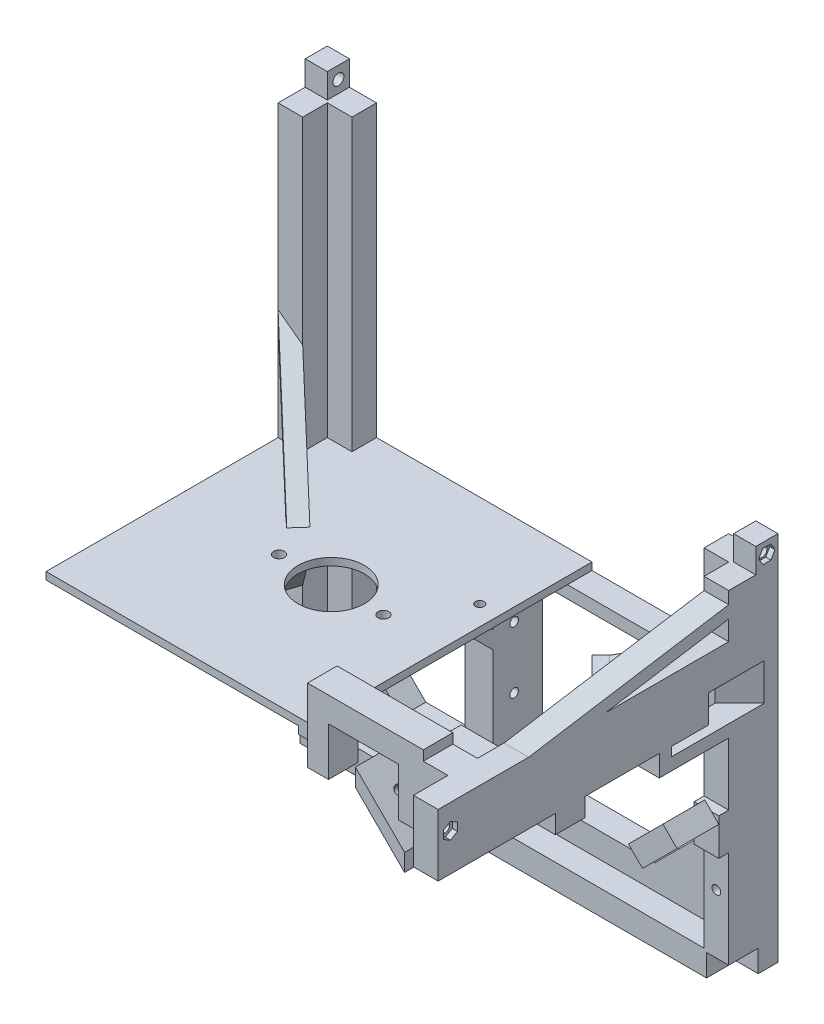
from build123d import *
from OCP.BRepFilletAPI import BRepFilletAPI_MakeChamfer

# Parameters (mm, degrees)
BOSS_EXTRUDE1_DEPTH       = 10
BOSS_EXTRUDE2_DEPTH       = 10
SKETCH3_W                 = 9
SKETCH3_H                 = 9
BOSS_EXTRUDE3_DEPTH       = 10
SKETCH5_W                 = 9
SKETCH5_H                 = 9
BOSS_EXTRUDE4_DEPTH       = 10
SKETCH6_R                 = 2.25
CUT_EXTRUDE1_DEPTH        = 9
SKETCH7_R                 = 2.25
CUT_EXTRUDE2_DEPTH        = 9
SKETCH8_R                 = 1.75
CUT_EXTRUDE3_DEPTH        = 250.05692246
SKETCH9_W                 = 10
SKETCH9_H                 = 25.2
BOSS_EXTRUDE5_DEPTH       = 118
BOSS_EXTRUDE8_DEPTH       = 5
CUT_EXTRUDE8_REACH        = 296.761
SKETCH17_W                = 16
SKETCH17_H                = 14
BOSS_EXTRUDE10_DEPTH      = 5
BOSS_EXTRUDE11_DEPTH      = 6.668368611
SKETCH22_W                = 50.253151342
SKETCH22_H                = 12
BOSS_EXTRUDE12_DEPTH      = 7.5
BOSS_EXTRUDE13_DEPTH      = 10
SKETCH26_W                = 12
SKETCH26_H                = 25.7
BOSS_EXTRUDE14_DEPTH      = 20
BOSS_EXTRUDE15_DEPTH      = 4
BOSS_EXTRUDE15_DEPTH_BACK = 6.1
SKETCH28_W                = 47
SKETCH28_H                = 12
SKETCH29_W                = 8.5
SKETCH29_H                = 19.6
BOSS_EXTRUDE16_DEPTH      = 12
SKETCH30_R                = 1.75
CUT_EXTRUDE11_DEPTH       = 10
SKETCH38_W                = 20
SKETCH38_H                = 13.31
BOSS_EXTRUDE19_DEPTH      = 5.1
SKETCH41_W                = 11.52
SKETCH41_H                = 20
BOSS_EXTRUDE21_DEPTH      = 90.06
SKETCH45_W                = 20
SKETCH45_H                = 28.01
BOSS_EXTRUDE25_DEPTH      = 34.49
BOSS_EXTRUDE26_DEPTH      = 11.52
SKETCH53_R                = 2.2
CUT_EXTRUDE20_DEPTH       = 5
CUT_EXTRUDE17_START       = -28.01
CUT_EXTRUDE17_DEPTH       = 23.01
BOSS_EXTRUDE27_REACH      = 284.27
SKETCH54_W                = 5
SKETCH54_H                = 5
SKETCH55_W                = 75.65
SKETCH55_H                = 5
BOSS_EXTRUDE28_DEPTH      = 10
SKETCH56_W                = 3.02
SKETCH56_H                = 26
CUT_EXTRUDE21_DEPTH       = 5
SKETCH23_W                = 18
SKETCH23_H                = 7.5
CUT_EXTRUDE22_DEPTH       = 2.2
CHAMFER1_SIZE             = 0.5
CHAMFER1_SIZE2            = 1.866025404
BOSS_EXTRUDE31_DEPTH      = 7.5
BOSS_EXTRUDE31_DEPTH_BACK = 7.5
SKETCH60_W                = 10
SKETCH60_H                = 4
BOSS_EXTRUDE32_DEPTH      = 17
SKETCH39_R                = 1.75
CUT_EXTRUDE25_DEPTH       = 10
SKETCH63_R                = 2.25
CUT_EXTRUDE26_DEPTH       = 10
SKETCH64_R                = 13.5
BOSS_EXTRUDE33_DEPTH      = 3
SKETCH65_R                = 2.2
CUT_EXTRUDE27_DEPTH       = 8.005
SKETCH66_R                = 1.75
CUT_EXTRUDE28_DEPTH       = 3
CUT_EXTRUDE30_DEPTH       = 2.1
CUT_EXTRUDE31_DEPTH       = 2.1
CUT_EXTRUDE32_DEPTH       = 2.1
SKETCH72_W                = 9
SKETCH72_H                = 9
CUT_EXTRUDE33_DEPTH       = 12
SKETCH74_R                = 1.8
CUT_EXTRUDE35_DEPTH       = 10
CHAMFER2_SIZE             = 0.5
CHAMFER2_SIZE2            = 1.866025404
BOSS_EXTRUDE34_DEPTH      = 2.18951549
CUT_EXTRUDE36_DEPTH       = 2.1
BOSS_EXTRUDE36_DEPTH      = 10
SKETCH82_W                = 16
SKETCH82_H                = 1
CUT_EXTRUDE37_DEPTH       = 37.542136
SKETCH83_R                = 2.25
BOSS_EXTRUDE37_DEPTH      = 6.8
BOSS_EXTRUDE38_DEPTH      = 12
BOSS_EXTRUDE39_DEPTH      = 13
BOSS_EXTRUDE41_DEPTH      = 2
CUT_EXTRUDE38_START       = -9.5
SKETCH89_W                = 25
SKETCH89_H                = 5
CUT_EXTRUDE38_DEPTH       = 9.5
SKETCH90_R                = 2.2
CUT_EXTRUDE39_DEPTH       = 5
CUT_EXTRUDE40_DEPTH       = 17
SKETCH93_R                = 1.75
CUT_EXTRUDE41_DEPTH       = 8.09
SKETCH94_R                = 1.75
CUT_EXTRUDE42_DEPTH       = 5
SKETCH95_R                = 1.75
CUT_EXTRUDE43_DEPTH       = 11.52


with BuildPart() as part:
    # Sketch1 → Boss-Extrude1 (new body)
    with BuildSketch(Plane.XY):
        Polygon((0, 0), (-91.5, 0), (-91.5, 220.775), (-71.5, 220.775), (-71.5, 40), (-51.5, 20), (0, 20), (51.5, 20), (71.5, 40), (71.5, 140.775), (91.5, 140.775), (91.5, 0), align=None)
    extrude(amount=BOSS_EXTRUDE1_DEPTH)

    # Sketch2 → Boss-Extrude2 (add)
    with BuildSketch(Plane.XY.offset(10)):
        Polygon((-81.5, 220.775), (-91.5, 220.775), (-91.5, 0), (91.5, 0), (91.5, 140.775), (81.5, 140.775), (81.5, 10), (-81.5, 10), align=None)
    extrude(amount=BOSS_EXTRUDE2_DEPTH)

    # Sketch3 → Boss-Extrude3 (add)
    with BuildSketch(Plane(origin=(0, 220.775, 0), x_dir=(1, 0, 0), z_dir=(0, 1, 0))):
        with Locations((-87, -4.5)):
            Rectangle(SKETCH3_W, SKETCH3_H)
    extrude(amount=BOSS_EXTRUDE3_DEPTH)

    # Sketch5 → Boss-Extrude4 (add)
    with BuildSketch(Plane(origin=(0, 140.775, 0), x_dir=(1, 0, 0), z_dir=(0, 1, 0))):
        with Locations((87, -4.5)):
            Rectangle(SKETCH5_W, SKETCH5_H)
    extrude(amount=BOSS_EXTRUDE4_DEPTH)

    # Sketch6 → Cut-Extrude1 (cut)
    with BuildSketch(Plane.ZY.offset(91.5)):
        with Locations(Location((4.5, 225.775, 0), (0, 0, 270))):
            Circle(SKETCH6_R)
    extrude(amount=-CUT_EXTRUDE1_DEPTH, mode=Mode.SUBTRACT)

    # Sketch7 → Cut-Extrude2 (cut)
    with BuildSketch(Plane(origin=(91.5, 0, 0), x_dir=(0, 0, -1), z_dir=(1, 0, 0))):
        with Locations(Location((-4.5, 145.775, 0), (0, 0, 90))):
            Circle(SKETCH7_R)
    extrude(amount=-CUT_EXTRUDE2_DEPTH, mode=Mode.SUBTRACT)

    # Sketch8 → Cut-Extrude3 (cut, through all)
    with BuildSketch(Plane(origin=(0, 0, 0), x_dir=(-1, 0, 0), z_dir=(0, 0, -1))):
        with Locations((86.5, 33)):
            Circle(SKETCH8_R)
        with Locations((-86.5, 33)):
            Circle(SKETCH8_R)
    extrude(amount=-CUT_EXTRUDE3_DEPTH, mode=Mode.SUBTRACT)

    # Sketch9 → Boss-Extrude5 (add)
    with BuildSketch(Plane.XY.offset(20)):
        with Locations((86.5, 110.165)):
            Rectangle(SKETCH9_W, SKETCH9_H)
    extrude(amount=BOSS_EXTRUDE5_DEPTH)

    # Sketch16 → Boss-Extrude8 (add)
    with BuildSketch(Plane(origin=(0, 107.915, 0), x_dir=(-1, 0, 0), z_dir=(0, -1, 0))):
        Polygon((-81.5, -38.192388155), (-81.5, -19.807611845), (-63.46877708, -37.838834765), (-72.661165235, -47.03122292), align=None)
    extrude(amount=-BOSS_EXTRUDE8_DEPTH)

    # Cut-Extrude8: up to this plane
    cut_extrude8_end = Plane(origin=(91.5, 140.775, 10), z_dir=(-1, 0, 0))
    # Sketch17 → Cut-Extrude8 (cut, up to the surface)
    with BuildSketch(Plane(origin=(12.814971157, 0, -12.814971157), x_dir=(0.7071067811865518, 0, 0.7071067811865434), z_dir=(-0.7071067811865434, 0, 0.7071067811865518)), mode=Mode.PRIVATE) as cut_extrude8_sk1:
        with Locations((76.635299321, 100.915)):
            Rectangle(SKETCH17_W, SKETCH17_H)
    cut_extrude8_tool1 = split(extrude(cut_extrude8_sk1.sketch, amount=-CUT_EXTRUDE8_REACH, mode=Mode.PRIVATE), bisect_by=cut_extrude8_end, keep=Keep.BOTH, mode=Mode.PRIVATE)
    add(cut_extrude8_tool1.solids().sort_by_distance((67.004311, 100.915, 41.374369))[0], mode=Mode.SUBTRACT)

    # Sketch20 → Boss-Extrude10 (add)
    with BuildSketch(Plane(origin=(0, 98.065, 0), x_dir=(1, 0, 0), z_dir=(0, 1, 0))):
        Polygon((-81.5, -20), (-91.5, -20), (-54.713161009, -52.918273519), (-54.713161009, -66.918273519), (-45.713161009, -66.918273519), (-45.713161009, -52.02343519), align=None)
    extrude(amount=BOSS_EXTRUDE10_DEPTH)

    # Sketch21 → Boss-Extrude11 (add)
    with BuildSketch(Plane(origin=(-50.626019377, 0, 56.575604505), x_dir=(0.7452037309705689, 0, 0.6668368611193775), z_dir=(-0.6668368611193775, 0, 0.7452037309705689))):
        Polygon((-5.484596308, 98.065), (-54.849404161, 48.700192147), (-54.849404161, 53.700192147), (-10.484596308, 98.065), align=None)
        Polygon((-54.849404161, 148.065), (-9.849404161, 103.065), (-14.849404161, 103.065), (-54.849404161, 143.065), align=None)
    extrude(amount=-BOSS_EXTRUDE11_DEPTH)

    # Sketch22 → Boss-Extrude12 (add)
    with BuildSketch(Plane.XZ.offset(-97.565)):
        with Locations((66.373424329, 84.38)):
            Rectangle(SKETCH22_W, SKETCH22_H)
    extrude(amount=BOSS_EXTRUDE12_DEPTH)

    # Sketch25 → Boss-Extrude13 (add)
    with BuildSketch(Plane(origin=(91.5, 0, 0), x_dir=(0, 0, -1), z_dir=(1, 0, 0))):
        Polygon((-20, 135.775), (-101.210986267, 122.765), (-70, 122.765), (-20, 130.775), align=None)
    extrude(amount=-BOSS_EXTRUDE13_DEPTH)

    # Sketch26 → Boss-Extrude14 (add)
    with BuildSketch(Plane.ZY.offset(-81.5)):
        with Locations((118.03, 109.915)):
            Rectangle(SKETCH26_W, SKETCH26_H)
    extrude(amount=BOSS_EXTRUDE14_DEPTH)

    # Sketch28 → Boss-Extrude15 (add, two sides: drawn at the far end of the back side and taken through both)
    with BuildSketch(Plane(origin=(0, 122.765, 0), x_dir=(1, 0, 0), z_dir=(0, 1, 0)).offset(-BOSS_EXTRUDE15_DEPTH_BACK)):
        with Locations((48, -118.03)):
            Rectangle(SKETCH28_W, SKETCH28_H)
    extrude(amount=BOSS_EXTRUDE15_DEPTH + BOSS_EXTRUDE15_DEPTH_BACK)

    # Sketch29 → Boss-Extrude16 (add)
    with BuildSketch(Plane.XY.offset(124.03)):
        with Locations((28.75, 106.865)):
            Rectangle(SKETCH29_W, SKETCH29_H)
    extrude(amount=-BOSS_EXTRUDE16_DEPTH)

    # Sketch30 → Cut-Extrude11 (cut)
    with BuildSketch(Plane.XZ.offset(-97.065)):
        with Locations(Location((29.75, 117.76, 0), (0, 0, 270))):
            Circle(SKETCH30_R)
        with Locations(Location((64.75, 117.76, 0), (0, 0, 270))):
            Circle(SKETCH30_R)
    extrude(amount=-CUT_EXTRUDE11_DEPTH, mode=Mode.SUBTRACT)

    # Sketch38 → Boss-Extrude19 (add)
    with BuildSketch(Plane(origin=(12.814971157, 0, -12.814971157), x_dir=(0.7071067811865579, 0, 0.7071067811865371), z_dir=(-0.7071067811865371, 0, 0.7071067811865579))):
        with Locations((74.588955898, 101.26)):
            Rectangle(SKETCH38_W, SKETCH38_H)
    extrude(amount=-BOSS_EXTRUDE19_DEPTH)

    # Sketch45 → Boss-Extrude25 (add)
    with BuildSketch(Plane.XZ):
        with Locations((-22.11, 34.005)):
            Rectangle(SKETCH45_W, SKETCH45_H)
    extrude(amount=-BOSS_EXTRUDE25_DEPTH)


with BuildPart() as body_2:
    # Sketch41 → Boss-Extrude21 (new body)
    with BuildSketch(Plane(origin=(0, 10, 0), x_dir=(1, 0, 0), z_dir=(0, 1, 0))):
        with Locations((-9.91, -10)):
            Rectangle(SKETCH41_W, SKETCH41_H)
    extrude(amount=BOSS_EXTRUDE21_DEPTH)


    add(part.part)  # Boss-Extrude26 merges part
    # Sketch52 → Boss-Extrude26 (add)
    with BuildSketch(Plane.ZY.offset(15.67)):
        Polygon((20, 100.06), (68, 100.06), (68, 95.06), (43, 95.06), (20, 72.06), (20, 79.131067812), (35.928932188, 95.06), (20, 95.06), align=None)
    extrude(amount=-BOSS_EXTRUDE26_DEPTH)

    # Sketch53 → Cut-Extrude20 (cut)
    with BuildSketch(Plane.XZ.offset(-95.06)):
        with Locations((-7.786838991, 60.918273519)):
            Circle(SKETCH53_R)
    extrude(amount=-CUT_EXTRUDE20_DEPTH, mode=Mode.SUBTRACT)

    # Sketch47 → Cut-Extrude17 (cut)
    with BuildSketch(Plane(origin=(0, 0, 20), x_dir=(-1, 0, 0), z_dir=(0, 0, -1)).offset(CUT_EXTRUDE17_START)):
        Polygon((39.920582555, 38.688332232), (4.453597068, 3.221346744), (-9.950768342, 17.625712154), (25.516217145, 53.092697642), align=None)
        Polygon((35.225802789, 26.922484654), (9.905484844, 1.602166709), (23.182353081, -11.674701529), (48.502671027, 13.645616416), align=None)
    extrude(amount=CUT_EXTRUDE17_DEPTH, mode=Mode.SUBTRACT)

    # Boss-Extrude27: up to this plane
    boss_extrude27_end = Plane(origin=(-15.67, 100.06, 20), z_dir=(1, 0, 0))
    # Sketch54 → Boss-Extrude27 (add, up to the surface)
    with BuildSketch(Plane(origin=(-46.179305384, 0, 51.606311337), x_dir=(-0.7452037309705689, 0, -0.6668368611193775), z_dir=(0.6668368611193775, 0, -0.7452037309705689)), mode=Mode.PRIVATE) as boss_extrude27_sk1:
        with Locations((4.113698153, 100.565)):
            Rectangle(SKETCH54_W, SKETCH54_H)
    boss_extrude27_tool1 = split(extrude(boss_extrude27_sk1.sketch, amount=BOSS_EXTRUDE27_REACH, mode=Mode.PRIVATE), bisect_by=boss_extrude27_end, keep=Keep.BOTH, mode=Mode.PRIVATE)
    add(boss_extrude27_tool1.solids().sort_by_distance((-49.244849, 100.565, 48.863146))[0])

    # Sketch55 → Boss-Extrude28 (add)
    with BuildSketch(Plane(origin=(0, 0, 0), x_dir=(-1, 0, 0), z_dir=(0, 0, -1))):
        with Locations((-33.675, 97.56)):
            Rectangle(SKETCH55_W, SKETCH55_H)
    extrude(amount=-BOSS_EXTRUDE28_DEPTH)

    # Sketch56 → Cut-Extrude21 (cut)
    with BuildSketch(Plane.XZ.offset(-95.06)):
        with Locations((-15.16, 56)):
            Rectangle(SKETCH56_W, SKETCH56_H)
    extrude(amount=-CUT_EXTRUDE21_DEPTH, mode=Mode.SUBTRACT)

    # Sketch23 → Cut-Extrude22 (cut)
    with BuildSketch(Plane.XY.offset(90.38)):
        with Locations((50.246848658, 93.815)):
            Rectangle(SKETCH23_W, SKETCH23_H)
    extrude(amount=-CUT_EXTRUDE22_DEPTH, mode=Mode.SUBTRACT)

    # Chamfer1: one chamfer whose edges measure the first distance from different faces: ONE call of the kernel's chamfer builder (chamfer() names one face for all edges)
    chamfer1_edges_1 = [body_2.edges().sort_by_distance(p)[0] for p in [
        (29.75, 97.065, 119.51),
    ]]
    chamfer1_side_1 = [body_2.faces().sort_by_distance(p)[0] for p in [
        (32.852945588, 97.065, 118.03),
    ]]
    chamfer1_edges_2 = [body_2.edges().sort_by_distance(p)[0] for p in [
        (64.75, 97.065, 119.51),
    ]]
    chamfer1_side_2 = [body_2.faces().sort_by_distance(p)[0] for p in [
        (71.781894819, 97.065, 118.041275793),
    ]]
    chamfer1 = BRepFilletAPI_MakeChamfer(body_2.part.solid().wrapped)
    for e in chamfer1_edges_1:
        chamfer1.Add(CHAMFER1_SIZE, CHAMFER1_SIZE2, e.wrapped, chamfer1_side_1[0].wrapped)  # the first distance lies on this face
    for e in chamfer1_edges_2:
        chamfer1.Add(CHAMFER1_SIZE, CHAMFER1_SIZE2, e.wrapped, chamfer1_side_2[0].wrapped)  # the first distance lies on this face
    add(Compound.cast(chamfer1.Shape()), mode=Mode.REPLACE)

    # Sketch60 → Boss-Extrude31 (add, two sides: drawn at the far end of the back side and taken through both)
    with BuildSketch(Plane(origin=(0, 56.04, 0), x_dir=(-1, 0, 0), z_dir=(0, -1, 0)).offset(-BOSS_EXTRUDE31_DEPTH_BACK)):
        with Locations((-86.5, -22)):
            Rectangle(SKETCH60_W, SKETCH60_H)
    extrude(amount=BOSS_EXTRUDE31_DEPTH + BOSS_EXTRUDE31_DEPTH_BACK)

    # Sketch61 → Boss-Extrude32 (add)
    with BuildSketch(Plane.XY.offset(24)):
        Polygon((85.277460326, 66.762539674), (71.277460326, 52.762539674), (77.5, 46.54), (91.5, 60.54), align=None)
    extrude(amount=BOSS_EXTRUDE32_DEPTH)

    # Sketch39 → Cut-Extrude25 (cut)
    with BuildSketch(Plane(origin=(91.5, 0, 0), x_dir=(0, 0, -1), z_dir=(1, 0, 0))):
        with Locations(Location((-133, 112.765, 0), (0, 0, 90))):
            Circle(SKETCH39_R)
    extrude(amount=-CUT_EXTRUDE25_DEPTH, mode=Mode.SUBTRACT)

    # Sketch63 → Cut-Extrude26 (cut)
    with BuildSketch(Plane(origin=(16.421215742, 0, -16.421215742), x_dir=(-0.7071067811865579, 0, -0.7071067811865372), z_dir=(0.7071067811865372, 0, -0.7071067811865579))):
        with Locations((-75.848955898, 102.51)):
            Circle(SKETCH63_R)
    extrude(amount=-CUT_EXTRUDE26_DEPTH, mode=Mode.SUBTRACT)

    # Sketch64 → Boss-Extrude33 (add)
    with BuildSketch(Plane(origin=(0, 103.065, 0), x_dir=(1, 0, 0), z_dir=(0, 1, 0))):
        Polygon((-91.5, -114.21951549), (-91.5, -14.5), (-81.5, -15), (-81.5, 0), (16, 0), (16, -114.21951549), align=None)
        with Locations(Location((-29, -60.918273519, 0), (0, 0, 270))):
            Circle(SKETCH64_R, mode=Mode.SUBTRACT)
    extrude(amount=-BOSS_EXTRUDE33_DEPTH)

    # Sketch65 → Cut-Extrude27 (cut)
    with BuildSketch(Plane.XZ.offset(-95.06)):
        with Locations((-7.786838991, 60.918273519)):
            Circle(SKETCH65_R)
        with Locations(Location((-50.213161009, 60.918273519, 0), (0, 0, 90))):
            Circle(SKETCH65_R)
    extrude(amount=-CUT_EXTRUDE27_DEPTH, mode=Mode.SUBTRACT)

    # Sketch66 → Cut-Extrude28 (cut)
    with BuildSketch(Plane.XZ.offset(-100.065)):
        with Locations(Location((8, 37.59, 0), (0, 0, 270))):
            Circle(SKETCH66_R)
    extrude(amount=-CUT_EXTRUDE28_DEPTH, mode=Mode.SUBTRACT)

    # Sketch69 → Cut-Extrude30 (cut)
    with BuildSketch(Plane(origin=(0, 0, 0), x_dir=(-1, 0, 0), z_dir=(0, 0, -1))):
        Polygon((-88.145448267, 30.15), (-84.854551733, 30.15), (-83.209103466, 33), (-84.854551733, 35.85), (-88.145448267, 35.85), (-89.790896534, 33), align=None)
        Polygon((88.145448267, 30.15), (89.790896534, 33), (88.145448267, 35.85), (84.854551733, 35.85), (83.209103466, 33), (84.854551733, 30.15), align=None)
    extrude(amount=-CUT_EXTRUDE30_DEPTH, mode=Mode.SUBTRACT)

    # Sketch70 → Cut-Extrude31 (cut)
    with BuildSketch(Plane(origin=(91.5, 0, 0), x_dir=(0, 0, -1), z_dir=(1, 0, 0))):
        Polygon((-2.854551733, 142.925), (-1.209103466, 145.775), (-2.854551733, 148.625), (-6.145448267, 148.625), (-7.790896534, 145.775), (-6.145448267, 142.925), align=None)
    extrude(amount=-CUT_EXTRUDE31_DEPTH, mode=Mode.SUBTRACT)

    # Sketch71 → Cut-Extrude32 (cut)
    with BuildSketch(Plane.ZY.offset(91.5)):
        Polygon((6.145448267, 222.925), (7.790896534, 225.775), (6.145448267, 228.625), (2.854551733, 228.625), (1.209103466, 225.775), (2.854551733, 222.925), align=None)
    extrude(amount=-CUT_EXTRUDE32_DEPTH, mode=Mode.SUBTRACT)

    # Sketch72 → Cut-Extrude33 (cut)
    with BuildSketch(Plane.XY.offset(20)):
        with Locations((87, 4.5)):
            Rectangle(SKETCH72_W, SKETCH72_H)
        with Locations((-87, 4.5)):
            Rectangle(SKETCH72_W, SKETCH72_H)
    extrude(amount=-CUT_EXTRUDE33_DEPTH, mode=Mode.SUBTRACT)

    # Sketch74 → Cut-Extrude35 (cut)
    with BuildSketch(Plane.XZ.offset(-9)):
        with Locations(Location((-87, 14, 0), (0, 0, 270))):
            Circle(SKETCH74_R)
        with Locations(Location((87, 14, 0), (0, 0, 270))):
            Circle(SKETCH74_R)
    extrude(amount=-CUT_EXTRUDE35_DEPTH, mode=Mode.SUBTRACT)

    # Chamfer2: one chamfer whose edges measure the first distance from different faces: ONE call of the kernel's chamfer builder (chamfer() names one face for all edges)
    chamfer2_edges_1 = [body_2.edges().sort_by_distance(p)[0] for p in [
        (-87, 9, 15.8),
    ]]
    chamfer2_side_1 = [body_2.faces().sort_by_distance(p)[0] for p in [
        (-82.65, 9, 14),
    ]]
    chamfer2_edges_2 = [body_2.edges().sort_by_distance(p)[0] for p in [
        (87, 9, 15.8),
    ]]
    chamfer2_side_2 = [body_2.faces().sort_by_distance(p)[0] for p in [
        (82.65, 9, 14),
    ]]
    chamfer2 = BRepFilletAPI_MakeChamfer(body_2.part.solid().wrapped)
    for e in chamfer2_edges_1:
        chamfer2.Add(CHAMFER2_SIZE, CHAMFER2_SIZE2, e.wrapped, chamfer2_side_1[0].wrapped)  # the first distance lies on this face
    for e in chamfer2_edges_2:
        chamfer2.Add(CHAMFER2_SIZE, CHAMFER2_SIZE2, e.wrapped, chamfer2_side_2[0].wrapped)  # the first distance lies on this face
    add(Compound.cast(chamfer2.Shape()), mode=Mode.REPLACE)

    # Sketch76 → Boss-Extrude34 (add)
    with BuildSketch(Plane(origin=(0, 0, 112.03), x_dir=(-1, 0, 0), z_dir=(0, 0, -1))):
        Polygon((-24.5, 97.065), (-11, 97.065), (-11, 100.065), (-16, 100.065), (-16, 102.065), (-24.5, 102.065), align=None)
    extrude(amount=-BOSS_EXTRUDE34_DEPTH)

    # Sketch77 → Cut-Extrude36 (cut)
    with BuildSketch(Plane(origin=(91.5, 0, 0), x_dir=(0, 0, -1), z_dir=(1, 0, 0))):
        Polygon((-130.15, 114.410448267), (-133, 116.055896534), (-135.85, 114.410448267), (-135.85, 111.119551733), (-133, 109.474103466), (-130.15, 111.119551733), align=None)
    extrude(amount=-CUT_EXTRUDE36_DEPTH, mode=Mode.SUBTRACT)

    # Sketch81 → Boss-Extrude36 (add)
    with BuildSketch(Plane(origin=(91.5, 0, 0), x_dir=(0, 0, -1), z_dir=(1, 0, 0))):
        Polygon((-20, 93.915), (-43.192388155, 93.915), (-43.192388155, 97.565), (-48.192388155, 97.565), (-48.192388155, 88.915), (-20, 88.915), align=None)
    extrude(amount=-BOSS_EXTRUDE36_DEPTH)

    # Sketch82 → Cut-Extrude37 (cut)
    with BuildSketch(Plane(origin=(16.421215742, 0, -16.421215742), x_dir=(-0.7071067811865581, 0, -0.7071067811865369), z_dir=(0.7071067811865369, 0, -0.7071067811865581))):
        with Locations((-76.635299321, 108.415)):
            Rectangle(SKETCH82_W, SKETCH82_H)
    extrude(amount=CUT_EXTRUDE37_DEPTH, mode=Mode.SUBTRACT)

    # Sketch83 → Boss-Extrude37 (add)
    with BuildSketch(Plane(origin=(12.814971157, 0, -12.814971157), x_dir=(0.7071067811865509, 0, 0.7071067811865441), z_dir=(-0.7071067811865441, 0, 0.7071067811865509))):
        Polygon((71.635299321, 112.915), (71.635299321, 107.915), (64.588955898, 107.915), (64.588955898, 94.605), (84.588955898, 94.605), (84.588955898, 107.915), (84.635299321, 107.915), (84.635299321, 112.915), align=None)
        with Locations(Location((75.848955898, 102.51, 0), (0, 0, 180))):
            Circle(SKETCH83_R, mode=Mode.SUBTRACT)
    extrude(amount=BOSS_EXTRUDE37_DEPTH)

    # Sketch85 → Boss-Extrude38 (add)
    with BuildSketch(Plane.XY.offset(90.38)):
        Polygon((64.322279096, 97.565), (81.5, 122.765), (81.5, 113.887870099), (70.373424329, 97.565), align=None)
    extrude(amount=-BOSS_EXTRUDE38_DEPTH)

    # Sketch86 → Boss-Extrude39 (add)
    with BuildSketch(Plane(origin=(50.653805922, 0, 50.653805922), x_dir=(-0.7071067811865435, 0, 0.7071067811865517), z_dir=(-0.7071067811865517, 0, -0.7071067811865435))):
        Polygon((-16.323106012, 112.915), (-43.623106012, 117.915), (-43.623106012, 112.915), align=None)
    extrude(amount=-BOSS_EXTRUDE39_DEPTH)

    # Sketch88 → Boss-Extrude41 (add)
    with BuildSketch(Plane.XZ.offset(-100.065)):
        Polygon((-51.736819587, 66.918273519), (-29, 89.655093106), (-7.344906894, 68), (-13.65, 68), (-29, 83.35), (-45.431726481, 66.918273519), align=None)
        Polygon((-49.213161009, 52.39461494), (-29, 40.181453931), (-8.786838991, 52.39461494), (-29, 32.181453931), align=None)
    extrude(amount=BOSS_EXTRUDE41_DEPTH)

    # Sketch89 → Cut-Extrude38 (cut)
    with BuildSketch(Plane.ZY.offset(13.65).offset(CUT_EXTRUDE38_START)):
        with Locations((55.5, 95.56)):
            Rectangle(SKETCH89_W, SKETCH89_H)
    extrude(amount=CUT_EXTRUDE38_DEPTH, mode=Mode.SUBTRACT)

    # Sketch90 → Cut-Extrude39 (cut)
    with BuildSketch(Plane.XZ.offset(-90.065)):
        with Locations(Location((47.246848658, 85.03, 0), (0, 0, 270))):
            Circle(SKETCH90_R)
    extrude(amount=-CUT_EXTRUDE39_DEPTH, mode=Mode.SUBTRACT)

    # Sketch91 → Cut-Extrude40 (cut)
    with BuildSketch(Plane.XY.offset(41)):
        Polygon((71.77950614, 52.26049386), (85.77950614, 66.26049386), (82.522327947, 69.517672053), (68.522327947, 55.517672053), align=None)
    extrude(amount=-CUT_EXTRUDE40_DEPTH, mode=Mode.SUBTRACT)

    # Sketch93 → Cut-Extrude41 (cut)
    with BuildSketch(Plane(origin=(15.48, -15.48, 0), x_dir=(0, 0, -1), z_dir=(0.7071067811865499, -0.7071067811865452, 0))):
        with Locations(Location((-32.29, 94.989525138, 0), (0, 0, 90))):
            Circle(SKETCH93_R)
    extrude(amount=-CUT_EXTRUDE41_DEPTH, mode=Mode.SUBTRACT)

    # Sketch94 → Cut-Extrude42 (cut)
    with BuildSketch(Plane(origin=(-4.151659068, -4.151659068, 0), x_dir=(0, 0, 1), z_dir=(-0.7071067811865488, -0.7071067811865462, 0))):
        with Locations(Location((38.66, 32.644793681, 0), (0, 0, 270))):
            Circle(SKETCH94_R)
    extrude(amount=-CUT_EXTRUDE42_DEPTH, mode=Mode.SUBTRACT)

    # Sketch95 → Cut-Extrude43 (cut)
    with BuildSketch(Plane(origin=(-4.15, 0, 0), x_dir=(0, 0, -1), z_dir=(1, 0, 0))):
        with Locations((-11.48, 52.66)):
            Circle(SKETCH95_R)
        with Locations((-11.48, 77.66)):
            Circle(SKETCH95_R)
    extrude(amount=-CUT_EXTRUDE43_DEPTH, mode=Mode.SUBTRACT)


solid = body_2.part
